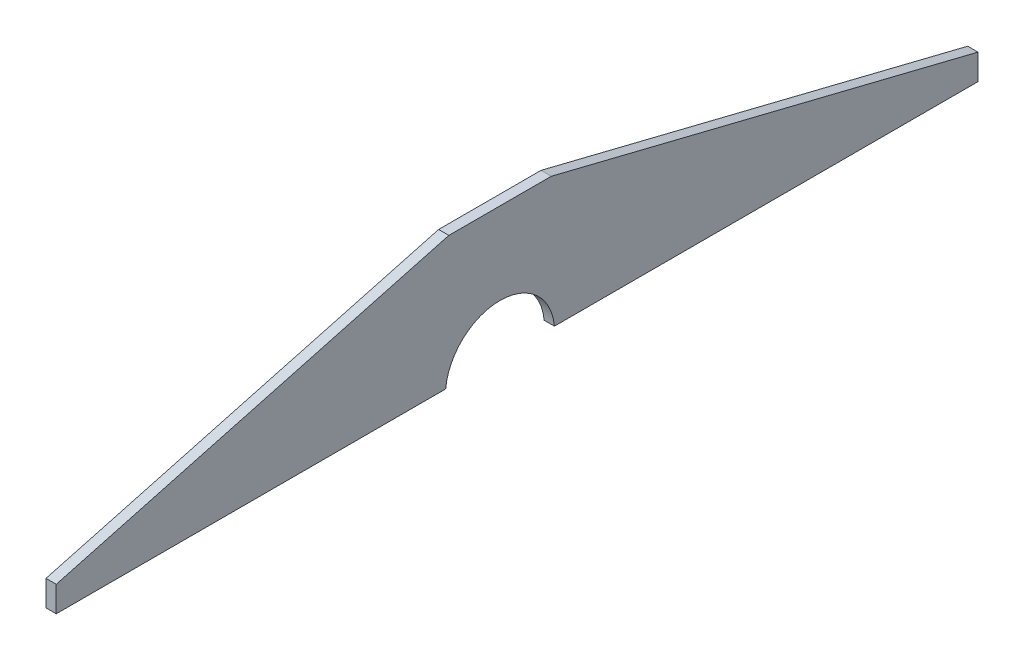
from build123d import *

# Parameters (mm, degrees)
BASE_FLANGE1_DEPTH = 6


# Sheet-metal steps are written as plain solids
with BuildPart() as part:
    # Sketch1 → Base-Flange1 (new body)
    with BuildSketch(Plane(origin=(0, 0, 0), x_dir=(0, 0, -1), z_dir=(1, 0, 0))):
        with BuildLine():
            Line((-31.859064644, 3), (-260, 3))
            Line((-260, 3), (-260, 18))
            Line((-260, 18), (-30, 80))
            Line((-30, 80), (30, 80))
            Line((30, 80), (280, 18))
            Line((280, 18), (280, 3))
            Line((280, 3), (31.859064644, 3))
            ThreePointArc((31.859064644, 3), (0, 32), (-31.859064644, 3))
        make_face()
    extrude(amount=-BASE_FLANGE1_DEPTH)


solid = part.part
